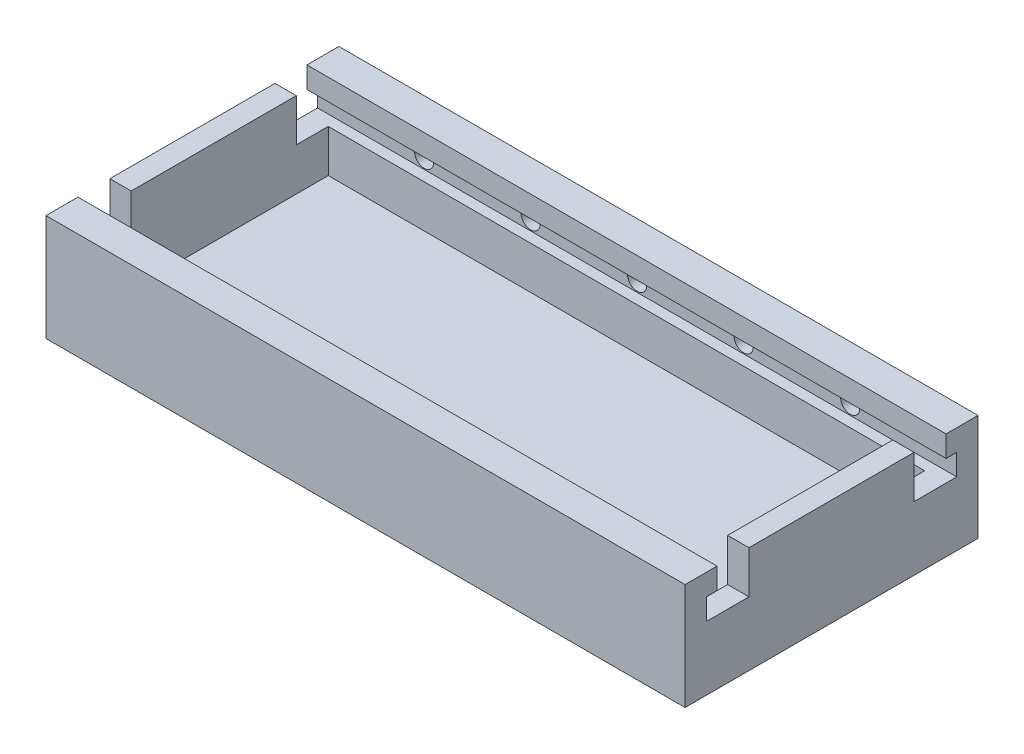
from build123d import *

# Parameters (mm, degrees)
SKETCH1_W                 = 76.2
SKETCH1_H                 = 34.925
BOSS_EXTRUDE1_DEPTH       = 12.7
SHELL1_T                  = -2.54
SHELL1_THICKNESS_2_FACE_W = 71.12
SHELL1_THICKNESS_2_FACE_H = 10.16
SHELL1_THICKNESS_2_DEPTH  = 1.27
SHELL1_THICKNESS_3_FACE_W = 71.12
SHELL1_THICKNESS_3_FACE_H = 10.16
SHELL1_THICKNESS_3_DEPTH  = 1.27
CUT_EXTRUDE4_DEPTH        = 28.575
CUT_EXTRUDE4_DEPTH_BACK   = 1.27
SKETCH10_W                = 76.2
SKETCH10_H                = 2.54
SKETCH11_W                = 2.54
SKETCH11_H                = 27.305
CUT_EXTRUDE5_DEPTH        = 2.54
FILL_START                = -10.141504854
FILL_PATTERN1_OUTLINE_R   = 1.143
FILL_PATTERN1_DEPTH       = 2.54
FILL_START_2              = 22.243495146
FILL_PATTERN2_OUTLINE_R   = 1.143
FILL_PATTERN2_DEPTH       = 2.54
SKETCH14_W                = 63.5
SKETCH14_H                = 5.08
BOSS_EXTRUDE2_DEPTH       = 0.762
SKETCH15_W                = 63.5
SKETCH15_H                = 5.08
BOSS_EXTRUDE3_DEPTH       = 0.762
SKETCH17_W                = 2.54
SKETCH17_H                = 19.685
BOSS_EXTRUDE4_DEPTH       = 5.08


# Read off the part's stored shape, not the designer's step: Fill Pattern1, Fill Pattern2
with BuildPart() as part:
    # Sketch1 → Boss-Extrude1 (new body)
    with BuildSketch(Plane(origin=(0, 0, 0), x_dir=(1, 0, 0), z_dir=(0, 1, 0))):
        with Locations((10.357281553, -7.320995146)):
            Rectangle(SKETCH1_W, SKETCH1_H)
    extrude(amount=BOSS_EXTRUDE1_DEPTH)

    # Shell1
    shell1_openings = [part.faces().sort_by_distance(p)[0] for p in [
        (10.357281553, 12.7, 7.320995146),
    ]]
    offset(amount=SHELL1_T, openings=shell1_openings, kind=Kind.INTERSECTION)

    # Shell1 thickness 2 face (on inner face of the shell) → Shell1 thickness 2 (add)
    with BuildSketch(Plane(origin=(10.357281553, 7.62, -7.601504854), x_dir=(-1, 0, 0), z_dir=(0, 0, -1))):
        Rectangle(SHELL1_THICKNESS_2_FACE_W, SHELL1_THICKNESS_2_FACE_H)
    extrude(amount=-SHELL1_THICKNESS_2_DEPTH)

    # Shell1 thickness 3 face (on inner face of the shell) → Shell1 thickness 3 (add)
    with BuildSketch(Plane(origin=(10.357281553, 7.62, 22.243495146), x_dir=(1, 0, 0), z_dir=(0, 0, 1))):
        Rectangle(SHELL1_THICKNESS_3_FACE_W, SHELL1_THICKNESS_3_FACE_H)
    extrude(amount=-SHELL1_THICKNESS_3_DEPTH)

    # Sketch10 → Cut-Extrude4 (cut, two sides: drawn at the far end of the back side and taken through both)
    with BuildSketch(Plane(origin=(0, 0, 20.973495146), x_dir=(-1, 0, 0), z_dir=(0, 0, -1)).offset(-CUT_EXTRUDE4_DEPTH_BACK)):
        with Locations((-10.357281553, 8.89)):
            Rectangle(SKETCH10_W, SKETCH10_H)
    extrude(amount=CUT_EXTRUDE4_DEPTH + CUT_EXTRUDE4_DEPTH_BACK, mode=Mode.SUBTRACT)

    # Sketch11 → Cut-Extrude5 (cut)
    with BuildSketch(Plane(origin=(0, 12.7, 0), x_dir=(1, 0, 0), z_dir=(0, 1, 0))):
        with Locations((-26.472718447, -7.320995146)):
            Rectangle(SKETCH11_W, SKETCH11_H)
        with Locations((47.187281553, -7.320995146)):
            Rectangle(SKETCH11_W, SKETCH11_H)
    extrude(amount=-CUT_EXTRUDE5_DEPTH, mode=Mode.SUBTRACT)

    # Fill Pattern1 outline → Fill Pattern1 (cut)
    with BuildSketch(Plane.XY.offset(FILL_START)):
        with Locations((10.357281553, 8.89)):
            Circle(FILL_PATTERN1_OUTLINE_R)
        with Locations((23.057281553, 8.89)):
            Circle(FILL_PATTERN1_OUTLINE_R)
        with Locations((35.757281553, 8.89)):
            Circle(FILL_PATTERN1_OUTLINE_R)
        with Locations((-2.342718447, 8.89)):
            Circle(FILL_PATTERN1_OUTLINE_R)
        with Locations((-15.042718447, 8.89)):
            Circle(FILL_PATTERN1_OUTLINE_R)
    extrude(amount=FILL_PATTERN1_DEPTH, mode=Mode.SUBTRACT)

    # Fill Pattern2 outline → Fill Pattern2 (cut)
    with BuildSketch(Plane.XY.offset(FILL_START_2)):
        with Locations((10.357281553, 8.89)):
            Circle(FILL_PATTERN2_OUTLINE_R)
        with Locations((23.057281553, 8.89)):
            Circle(FILL_PATTERN2_OUTLINE_R)
        with Locations((35.757281553, 8.89)):
            Circle(FILL_PATTERN2_OUTLINE_R)
        with Locations((-2.342718447, 8.89)):
            Circle(FILL_PATTERN2_OUTLINE_R)
        with Locations((-15.042718447, 8.89)):
            Circle(FILL_PATTERN2_OUTLINE_R)
    extrude(amount=FILL_PATTERN2_DEPTH, mode=Mode.SUBTRACT)

    # Sketch14 → Boss-Extrude2 (add)
    with BuildSketch(Plane.XY.offset(24.783495146)):
        with Locations((10.357281553, 8.89)):
            Rectangle(SKETCH14_W, SKETCH14_H)
    extrude(amount=-BOSS_EXTRUDE2_DEPTH)

    # Sketch15 → Boss-Extrude3 (add)
    with BuildSketch(Plane(origin=(0, 0, -10.141504854), x_dir=(-1, 0, 0), z_dir=(0, 0, -1))):
        with Locations((-10.357281553, 8.89)):
            Rectangle(SKETCH15_W, SKETCH15_H)
    extrude(amount=-BOSS_EXTRUDE3_DEPTH)

    # Sketch17 → Boss-Extrude4 (add)
    with BuildSketch(Plane(origin=(0, 7.62, 0), x_dir=(1, 0, 0), z_dir=(0, 1, 0))):
        with Locations((-26.472718447, -7.320995146)):
            Rectangle(SKETCH17_W, SKETCH17_H)
        with Locations((47.187281553, -7.320995146)):
            Rectangle(SKETCH17_W, SKETCH17_H)
    extrude(amount=BOSS_EXTRUDE4_DEPTH)


solid = part.part
